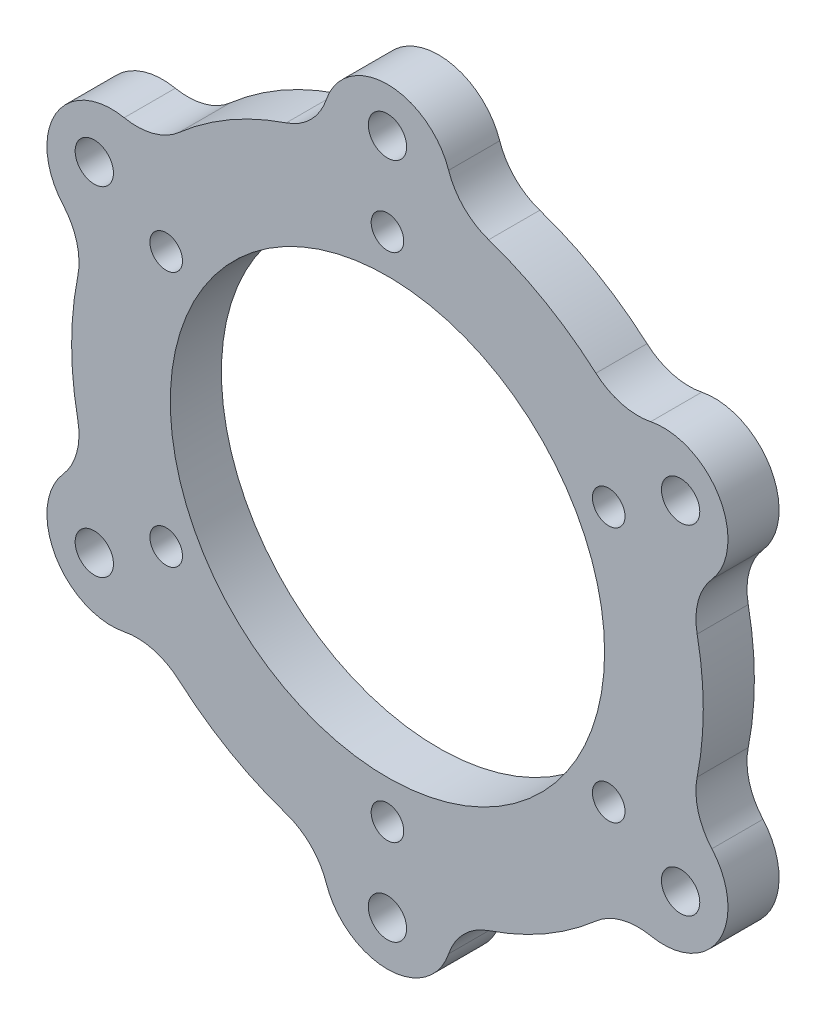
from build123d import *

# Parameters (mm, degrees)
SKETCH2_R           = 3
SKETCH2_R_2         = 2.55
SKETCH2_R_3         = 34
BOSS_EXTRUDE1_DEPTH = 8


with BuildPart() as part:
    # Sketch2 → Boss-Extrude1 (new body)
    with BuildSketch(Plane.XY):
        with BuildLine():
            ThreePointArc((50.792573497, 18.265840665), (51.961524227, 30), (41.214968786, 34.85473864))
            ThreePointArc((41.214968786, 34.85473864), (36.65999643, 34.997336465), (32.641290086, 37.146314508))
            ThreePointArc((32.641290086, 37.146314508), (24.725, 42.824956217), (15.849006977, 46.841343681))
            ThreePointArc((15.849006977, 46.841343681), (11.978584229, 49.247156444), (9.577604711, 53.120579305))
            ThreePointArc((9.577604711, 53.120579305), (0, 60), (-9.577604711, 53.120579305))
            ThreePointArc((-9.577604711, 53.120579305), (-11.978584229, 49.247156444), (-15.849006977, 46.841343681))
            ThreePointArc((-15.849006977, 46.841343681), (-24.725, 42.824956217), (-32.641290086, 37.146314508))
            ThreePointArc((-32.641290086, 37.146314508), (-36.65999643, 34.997336465), (-41.214968786, 34.85473864))
            ThreePointArc((-41.214968786, 34.85473864), (-51.961524227, 30), (-50.792573497, 18.265840665))
            ThreePointArc((-50.792573497, 18.265840665), (-48.638580659, 14.249819979), (-48.490297064, 9.695029173))
            ThreePointArc((-48.490297064, 9.695029173), (-49.45, 0), (-48.490297064, -9.695029173))
            ThreePointArc((-48.490297064, -9.695029173), (-48.638580659, -14.249819979), (-50.792573497, -18.265840665))
            ThreePointArc((-50.792573497, -18.265840665), (-51.961524227, -30), (-41.214968786, -34.85473864))
            ThreePointArc((-41.214968786, -34.85473864), (-36.65999643, -34.997336465), (-32.641290086, -37.146314508))
            ThreePointArc((-32.641290086, -37.146314508), (-24.725, -42.824956217), (-15.849006977, -46.841343681))
            ThreePointArc((-15.849006977, -46.841343681), (-11.978584229, -49.247156444), (-9.577604711, -53.120579305))
            ThreePointArc((-9.577604711, -53.120579305), (0, -60), (9.577604711, -53.120579305))
            ThreePointArc((9.577604711, -53.120579305), (11.978584229, -49.247156444), (15.849006977, -46.841343681))
            ThreePointArc((15.849006977, -46.841343681), (24.725, -42.824956217), (32.641290086, -37.146314508))
            ThreePointArc((32.641290086, -37.146314508), (36.65999643, -34.997336465), (41.214968786, -34.85473864))
            ThreePointArc((41.214968786, -34.85473864), (51.961524227, -30), (50.792573497, -18.265840665))
            ThreePointArc((50.792573497, -18.265840665), (48.638580659, -14.249819979), (48.490297064, -9.695029173))
            ThreePointArc((48.490297064, -9.695029173), (49.45, 0), (48.490297064, 9.695029173))
            ThreePointArc((48.490297064, 9.695029173), (48.638580659, 14.249819979), (50.792573497, 18.265840665))
        make_face()
        with Locations((45.899346401, 26.5)):
            Circle(SKETCH2_R, mode=Mode.SUBTRACT)
        with Locations((0, 53)):
            Circle(SKETCH2_R, mode=Mode.SUBTRACT)
        with Locations((-34.641016151, -20)):
            Circle(SKETCH2_R_2, mode=Mode.SUBTRACT)
        with Locations((0, -40)):
            Circle(SKETCH2_R_2, mode=Mode.SUBTRACT)
        with Locations((34.641016151, -20)):
            Circle(SKETCH2_R_2, mode=Mode.SUBTRACT)
        with Locations((-34.641016151, 20)):
            Circle(SKETCH2_R_2, mode=Mode.SUBTRACT)
        with Locations((0, 40)):
            Circle(SKETCH2_R_2, mode=Mode.SUBTRACT)
        Circle(SKETCH2_R_3, mode=Mode.SUBTRACT)
        with Locations((34.641016151, 20)):
            Circle(SKETCH2_R_2, mode=Mode.SUBTRACT)
        with Locations((45.899346401, -26.5)):
            Circle(SKETCH2_R, mode=Mode.SUBTRACT)
        with Locations((0, -53)):
            Circle(SKETCH2_R, mode=Mode.SUBTRACT)
        with Locations((-45.899346401, -26.5)):
            Circle(SKETCH2_R, mode=Mode.SUBTRACT)
        with Locations((-45.899346401, 26.5)):
            Circle(SKETCH2_R, mode=Mode.SUBTRACT)
    extrude(amount=BOSS_EXTRUDE1_DEPTH)


solid = part.part
